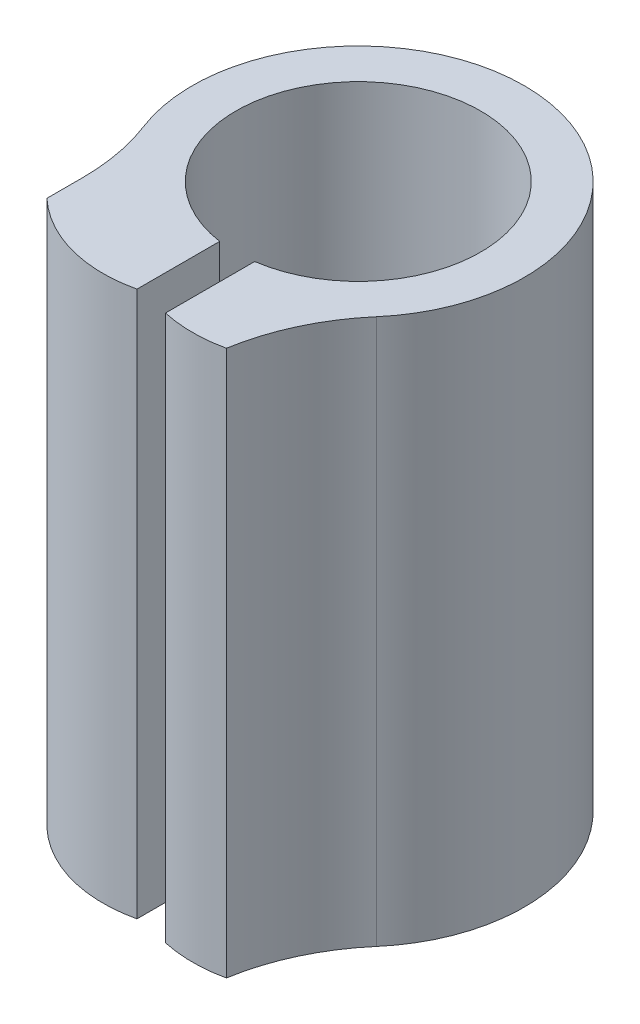
from build123d import *

# Parameters (mm, degrees)
BOSS_EXTRUDE1_DEPTH = 78
SKETCH2_R           = 17.5
CUT_EXTRUDE1_DEPTH  = 39
FILLET1_R           = 30


with BuildPart() as part:
    # Sketch1 → Boss-Extrude1 (new body)
    with BuildSketch(Plane(origin=(0, 0, 0), x_dir=(1, 0, 0), z_dir=(0, 1, 0))):
        with BuildLine():
            Line((2.5, -14.079772725), (2.5, -21.006468516))
            Line((2.5, -21.006468516), (2.5, -30.076468516))
            ThreePointArc((2.5, -30.076468516), (6.86, -30.550052571), (11.22, -30.076468516))
            Line((11.22, -30.076468516), (11.22, -20.932608533))
            ThreePointArc((11.22, -20.932608533), (6.153268827, 22.93904494), (-20.19, -12.50705401))
            Line((-20.19, -12.50705401), (-20.19, -24.339979577))
            ThreePointArc((-20.19, -24.339979577), (-11.948714524, -28.965226171), (-2.5, -29.148218549))
            Line((-2.5, -29.148218549), (-2.5, -21.006468516))
            Line((-2.5, -21.006468516), (-2.5, -14.079772725))
            ThreePointArc((-2.5, -14.079772725), (0, 14.3), (2.5, -14.079772725))
        make_face()
    extrude(amount=BOSS_EXTRUDE1_DEPTH)

    # Sketch2 → Cut-Extrude1 (cut)
    with BuildSketch(Plane(origin=(0, 78, 0), x_dir=(1, 0, 0), z_dir=(0, 1, 0))):
        Circle(SKETCH2_R)
    extrude(amount=-CUT_EXTRUDE1_DEPTH, mode=Mode.SUBTRACT)

    # Fillet1
    # the kernel refuses this fillet: 30 mm, written as the material it adds along each edge
    with BuildSketch(Plane(origin=(11.22, 0, 20.932608533), x_dir=(0.7793190463800559, 0, -0.626627340569561), z_dir=(0, 1, 0))) as fillet1_piece_1:
        with BuildLine():
            CenterArc((14.269740905, -29.487081198), FILLET1_R, 100.610162443, 31.198957304)
            Line((-5.729792663, -7.125984242), (-6.129783335, -6.678762303))
            ThreePointArc((-6.129783335, -6.678762303), (-3.33248776, -3.187015717), (-0.467591428, 0.375976404))
            Line((-0.467591428, 0.375976404), (0.110475413, 0.589741624))
            ThreePointArc((0.110475413, 0.589741624), (4.372985116, 0.193939281), (8.635494818, 0.589741624))
            Line((8.635494818, 0.589741624), (8.745970232, 0))
        make_face()
    extrude(amount=78)
    with BuildSketch(Plane(origin=(-20.19, 0, 12.50705401), x_dir=(0, 0, 1), z_dir=(0, 1, 0))) as fillet1_piece_2:
        with BuildLine():
            CenterArc((6.729016275, -30), FILLET1_R, 90, 20.970079677)
            Line((-4.007395047, -1.986976744), (-4.222123273, -1.426716279))
            ThreePointArc((-4.222123273, -1.426716279), (-2.22334858, -0.55048945), (-0.31596768, 0.510063158))
            Line((-0.31596768, 0.510063158), (0, 0.6))
            Line((0, 0.6), (6.729016275, 0.6))
            Line((6.729016275, 0.6), (6.729016275, 0))
        make_face()
    extrude(amount=78)


solid = part.part
